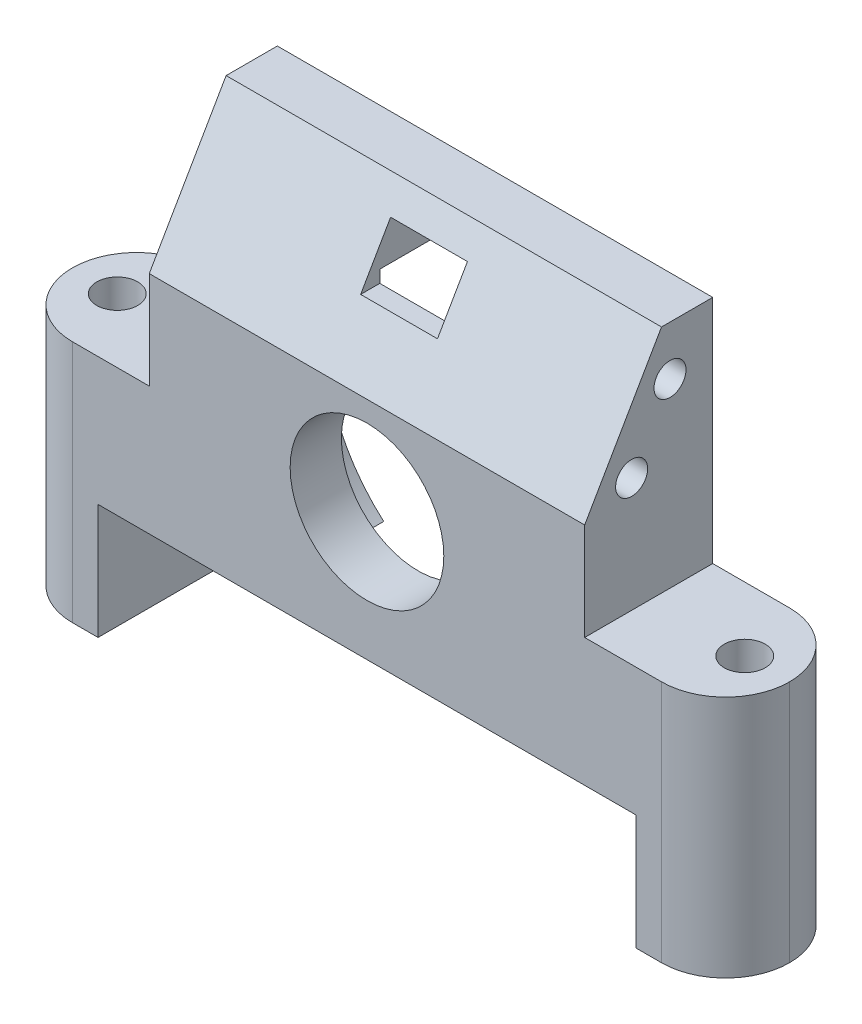
from build123d import *
from build123d.topology import SkipClean

# Parameters (mm, degrees)
SKETCH1_R                   = 6
EXTRUDE1_DEPTH              = 10
SKETCH2_R                   = 13.25
CUT_EXTRUDE1_DEPTH          = 6
SKETCH3_R                   = 1.6
CUT_EXTRUDE2_DEPTH          = 10
SKETCH4_W                   = 7
SKETCH4_H                   = 10
SKETCH4_R                   = 1.6
EXTRUDE3_DEPTH              = 9
FILLET2_R                   = 5
CHAMFER4_SIZE               = 6
CHAMFER4_SIZE2              = 10.392304845
M4_TAPPED_HOLE1_D           = 3.3
M4_TAPPED_HOLE1_DEPTH       = 10.1
M4_TAPPED_HOLE1_TIP         = 0.991420021
SKETCH6_R                   = 1.25
EXTRUDE4_DEPTH              = 4
M3_START                    = 12.4999999
M3_TAPPED_HOLE1_OUTLINE_R   = 1.25
M3_TAPPED_HOLE1_DEPTH       = 0.5000001
M3_START_2                  = -13
M3_TAPPED_HOLE1_2_OUTLINE_R = 1.25
M3_TAPPED_HOLE1_2_DEPTH     = 0.4999999
EXTRUDE5_REACH              = 37.285
SKETCH8_W                   = 6
SKETCH8_H                   = 4.052940251


with BuildPart() as part:
    # Sketch1 → Extrude1 (new body)
    with BuildSketch(Plane.XY):
        Polygon((-17, 0), (-28, 0), (-28, -10), (28, -10), (28, 0), (17, 0), (17, 18), (-17, 18), align=None)
        with Locations((0, 6.53e-07)):
            Circle(SKETCH1_R, mode=Mode.SUBTRACT)
    extrude(amount=EXTRUDE1_DEPTH)

    # Sketch2 → Cut-Extrude1 (cut)
    with BuildSketch(Plane(origin=(0, 0, 0), x_dir=(-1, 0, 0), z_dir=(0, 0, -1))):
        Circle(SKETCH2_R)
    extrude(amount=-CUT_EXTRUDE1_DEPTH, mode=Mode.SUBTRACT)

    # Sketch3 → Cut-Extrude2 (cut)
    with BuildSketch(Plane(origin=(0, 0, 0), x_dir=(-1, 0, 0), z_dir=(0, 1, 0))):
        with Locations(Location((-24.5, 5, 0), (0, 0, 90))):
            Circle(SKETCH3_R)
        with Locations(Location((24.5, 5, 0), (0, 0, 90))):
            Circle(SKETCH3_R)
    extrude(amount=-CUT_EXTRUDE2_DEPTH, mode=Mode.SUBTRACT)

    # Sketch4 → Extrude3 (add)
    # profile 1 of 2: a face of its own
    with SkipClean():  # the faces are left unmerged after this step: merging them gives an invalid solid
        with BuildSketch(Plane.XZ.offset(10)):
            with Locations((-24.5, 5)):
                Rectangle(SKETCH4_W, SKETCH4_H)
            with Locations((-24.5, 5)):
                Circle(SKETCH4_R, mode=Mode.SUBTRACT)
        # profile 2 of 2: a face of its own
        with BuildSketch(Plane.XZ.offset(10)):
            with Locations((24.5, 5)):
                Rectangle(SKETCH4_W, SKETCH4_H)
            with Locations((24.5, 5)):
                Circle(SKETCH4_R, mode=Mode.SUBTRACT)
        extrude(amount=EXTRUDE3_DEPTH)
    add(part.part.scale(1), mode=Mode.REPLACE)  # the faces are merged on a copy

    # Fillet2
    fillet2_edges = [part.edges().sort_by_distance(p)[0] for p in [
        (28, -5, 0),
        (28, -5, 10),
        (-28, -9.5, 0),
        (-28, -9.5, 10),
    ]]
    fillet(fillet2_edges, radius=FILLET2_R - 0.0001)  # a hair under: the kernel refuses the full size

    # Chamfer4
    chamfer4_edges = [part.edges().sort_by_distance(p)[0] for p in [
        (0, 18, 10),
    ]]
    chamfer4_side = [part.faces().sort_by_distance(p)[0] for p in [
        (0, 18, 5),
    ]]
    chamfer(chamfer4_edges, length=CHAMFER4_SIZE, length2=CHAMFER4_SIZE2, reference=chamfer4_side[0])

    # M4 Tapped Hole1
    with Locations(Plane(origin=(-24.5, -19, 5), x_dir=(0, 0, -1), z_dir=(0, -1, 0))):
        with Locations((0, 0), (0, 49)):
            Hole(M4_TAPPED_HOLE1_D / 2, depth=M4_TAPPED_HOLE1_DEPTH)
            with Locations((0, 0, -(M4_TAPPED_HOLE1_DEPTH + M4_TAPPED_HOLE1_TIP / 2))):  # 118° drill point
                Cone(0, M4_TAPPED_HOLE1_D / 2, M4_TAPPED_HOLE1_TIP, mode=Mode.SUBTRACT)

    # Sketch6 → Extrude4 (cut)
    with BuildSketch(Plane.ZY.offset(17)):
        with Locations((3.33604719, 14.15)):
            Circle(SKETCH6_R)
        with Locations((6.332495088, 8.96)):
            Circle(SKETCH6_R)
    extrude4 = extrude(amount=-EXTRUDE4_DEPTH, mode=Mode.SUBTRACT)

    # Mirror1: Extrude4 across plane
    add(extrude4.mirror(Plane(origin=(0, 0, 0), x_dir=(0, 0, 1), z_dir=(1, 0, 0))), mode=Mode.SUBTRACT)

    # M3 Tapped Hole1: read off the stored shape, not the designer's step
    # M3 Tapped Hole1 outline → M3 Tapped Hole1 (cut)
    with BuildSketch(Plane.YZ.offset(M3_START)):
        with Locations((14.15, 3.33604719)):
            Circle(M3_TAPPED_HOLE1_OUTLINE_R)
        with Locations((8.96, 6.332495088)):
            Circle(M3_TAPPED_HOLE1_OUTLINE_R)
    extrude(amount=M3_TAPPED_HOLE1_DEPTH, mode=Mode.SUBTRACT)

    # M3 Tapped Hole1 2 outline → M3 Tapped Hole1 2 (cut)
    with BuildSketch(Plane.YZ.offset(M3_START_2)):
        with Locations((14.15, 3.33604719)):
            Circle(M3_TAPPED_HOLE1_2_OUTLINE_R)
        with Locations((8.96, 6.332495088)):
            Circle(M3_TAPPED_HOLE1_2_OUTLINE_R)
    extrude(amount=M3_TAPPED_HOLE1_2_DEPTH, mode=Mode.SUBTRACT)

    # M3 Tapped Hole1 3 outline → M3 Tapped Hole1 3 (revolve, cut)
    with BuildSketch(Plane(origin=(0, 14.15, 3.33604719), x_dir=(0, 1, 0), z_dir=(0, 0, -1))):
        Polygon((0, 12.5), (0, 11.748924226), (1.25, 12.5), align=None)
        Polygon((1.25, -12.5), (0, -11.748924226), (0, -12.5000001), align=None)
    revolve(axis=Axis((0, 14.15, 3.33604719), (1, 0, 0)), mode=Mode.SUBTRACT)

    # M3 Tapped Hole1 4 outline → M3 Tapped Hole1 4 (revolve, cut)
    with BuildSketch(Plane(origin=(0, 8.96, 6.332495088), x_dir=(0, 1, 0), z_dir=(0, 0, -1))):
        Polygon((0, 12.5), (0, 11.748924226), (1.25, 12.5), align=None)
        Polygon((1.25, -12.5), (0, -11.748924226), (0, -12.5000001), align=None)
    revolve(axis=Axis((0, 8.96, 6.332495088), (1, 0, 0)), mode=Mode.SUBTRACT)

    # Extrude5: up to this face of the body (flat: up to its plane)
    extrude5_end = Plane(part.part.faces().sort_by_distance((-16.468587934, 3.803847577, 10))[0])
    # Sketch8 → Extrude5 (cut, up to the picked face)
    with BuildSketch(Plane(origin=(0, 0, 0), x_dir=(-1, 0, 0), z_dir=(0, 0, -1)), mode=Mode.PRIVATE) as extrude5_sk1:
        with Locations((0, 13.973529875)):
            Rectangle(SKETCH8_W, SKETCH8_H)
    extrude5_tool1 = split(extrude(extrude5_sk1.sketch, amount=-EXTRUDE5_REACH, mode=Mode.PRIVATE), bisect_by=extrude5_end, keep=Keep.BOTH, mode=Mode.PRIVATE)
    add(extrude5_tool1.solids().sort_by(Axis((0, 13.97353, 0), (0, 0, 1)))[0], mode=Mode.SUBTRACT)


solid = part.part
